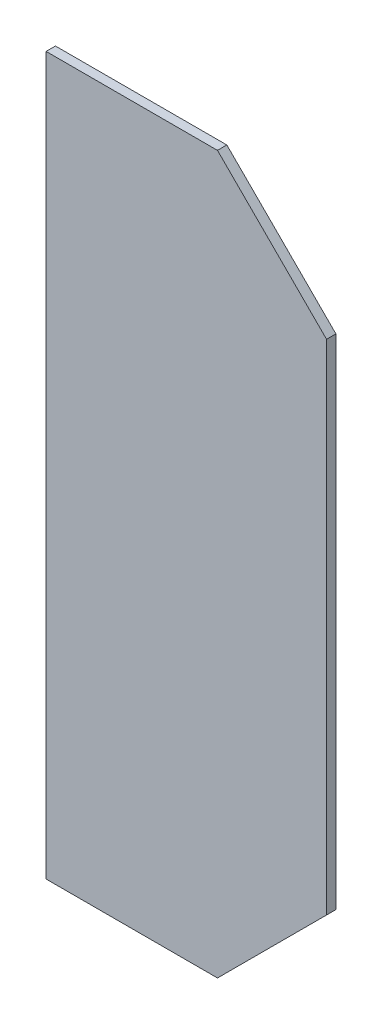
from build123d import *

# Parameters (mm, degrees)
SKETCH1_W           = 90
SKETCH1_H           = 230
BOSS_EXTRUDE1_DEPTH = 3
CHAMFER2_SIZE       = 35


with BuildPart() as part:
    # Sketch1 → Boss-Extrude1 (new body)
    with BuildSketch(Plane.XY):
        Rectangle(SKETCH1_W, SKETCH1_H)
    extrude(amount=BOSS_EXTRUDE1_DEPTH)

    # Chamfer2
    chamfer2_edges = [part.edges().sort_by_distance(p)[0] for p in [
        (45, -115, 1.5),
        (45, 115, 1.5),
    ]]
    chamfer(chamfer2_edges, length=CHAMFER2_SIZE)


solid = part.part
